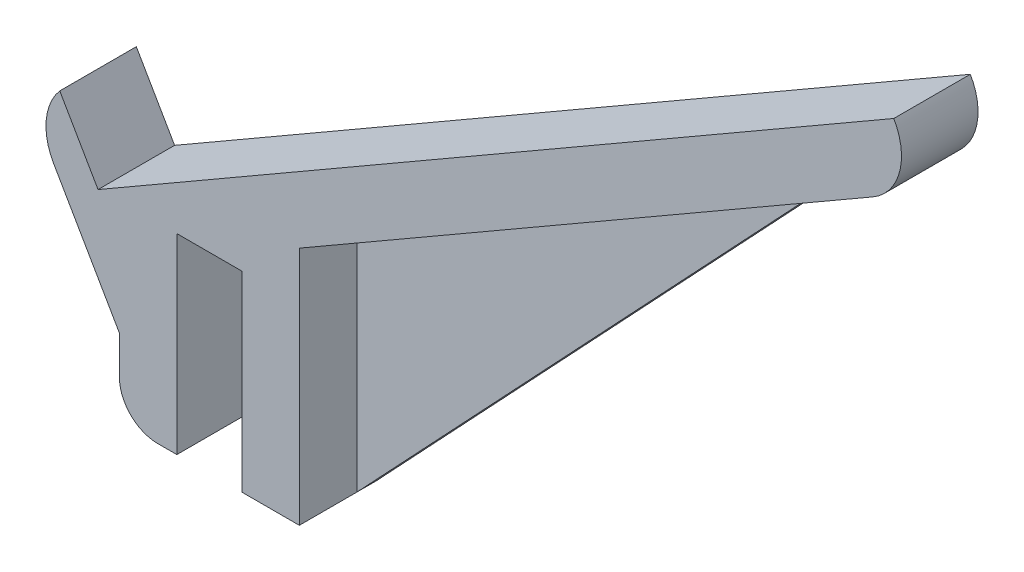
from build123d import *

# Parameters (mm, degrees)
BOSS_EXTRUDE1_DEPTH = 20
BOSS_EXTRUDE2_DEPTH = 5
FILLET1_R           = 15
FILLET2_R           = 10
FILLET3_R           = 15


# Some blends are built 0.0001 mm under size
with BuildPart() as part:
    # Sketch1 → Boss-Extrude1 (new body)
    with BuildSketch(Plane.XY):
        Polygon((0, 0), (0, -50), (15, -50), (15, 12.701705922), (177.765969889, 106.674682453), (170.265969889, 119.665063509), (-37.580127019, -0.334936491), (-47.580127019, 16.985571585), (-56.240381057, 11.985571585), (-32, -30), (-32, -50), (-17, -50), (-17, 0), align=None)
    extrude(amount=BOSS_EXTRUDE1_DEPTH)

    # Sketch2 → Boss-Extrude2 (add)
    with BuildSketch(Plane.XY):
        Polygon((15, -50), (143.985349671, 87.171432276), (15, 12.701705922), align=None)
    extrude(amount=BOSS_EXTRUDE2_DEPTH)

    # Fillet1
    # the kernel refuses this fillet: 15 mm, written as the material it takes off along each edge
    with BuildSketch(Plane(origin=(-56.240381057, 11.985571585, -35.355339059), x_dir=(0.866025403784439, 0.4999999999999994, 0), z_dir=(0, 0, 1))) as fillet1_piece_1:
        with BuildLine():
            CenterArc((15, -14.142135624), FILLET1_R, 109.471220634, 70.528779366)
            Line((0, -14.142135624), (-0.3, -14.142135624))
            Line((-0.3, -14.142135624), (-0.3, 0))
            Line((-0.3, 0), (0, 0.3))
            ThreePointArc((0, 0.3), (5, 0.3), (9.9, 0.282842712))
            Line((9.9, 0.282842712), (10, 0))
        make_face()
    extrude(amount=90.710678119, mode=Mode.SUBTRACT)

    # Fillet2
    fillet2_edges = [part.edges().sort_by_distance(p)[0] for p in [
        (-32, -50, 10),
    ]]
    fillet(fillet2_edges, radius=FILLET2_R)

    # Fillet3
    fillet3_edges = [part.edges().sort_by_distance(p)[0] for p in [
        (177.765969889, 106.674682453, 10),
    ]]
    fillet(fillet3_edges, radius=FILLET3_R - 0.0001)  # a hair under: the kernel refuses the full size


solid = part.part
